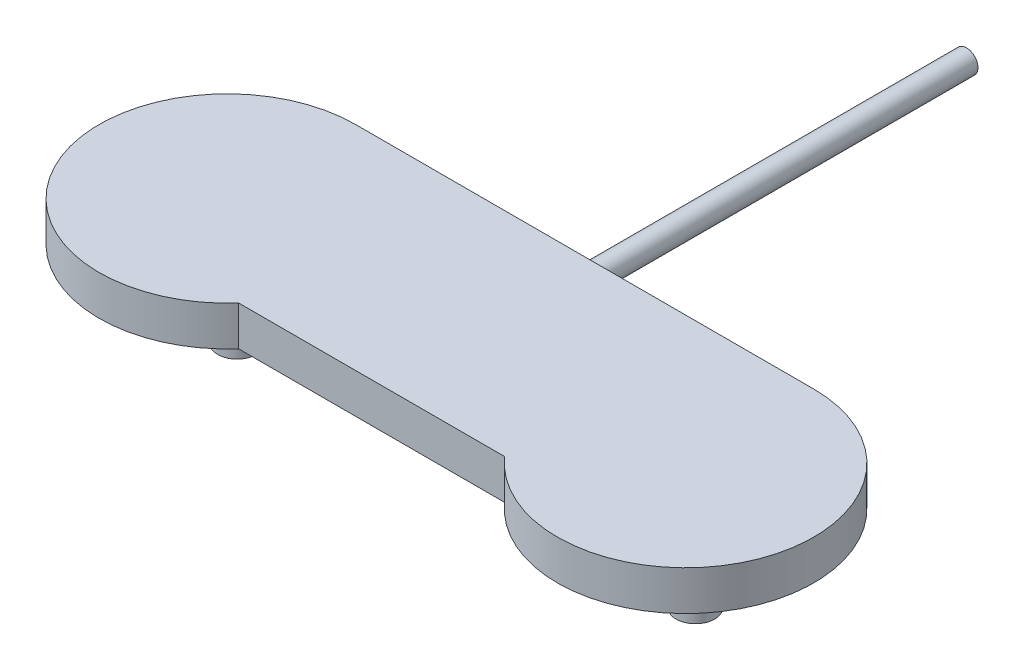
from build123d import *

# Parameters (mm, degrees)
BOSS_EXTRUDE1_DEPTH = 5
SKETCH2_R           = 2.444777137
BOSS_EXTRUDE2_DEPTH = 3
SKETCH4_R           = 1.447783819
BOSS_EXTRUDE3_DEPTH = 48


with BuildPart() as part:
    # Sketch1 → Boss-Extrude1 (new body)
    with BuildSketch(Plane(origin=(0, 0, 0), x_dir=(1, 0, 0), z_dir=(0, 1, 0))):
        with BuildLine():
            Line((0, 16.15299729), (57.736574248, 16.15299729))
            ThreePointArc((57.736574248, 16.15299729), (72.459068519, -6.645862163), (45.621959745, -10.684354773))
            Line((45.621959745, -10.684354773), (12.114614503, -10.684354773))
            ThreePointArc((12.114614503, -10.684354773), (-14.722494271, -6.645862163), (0, 16.15299729))
        make_face()
    extrude(amount=BOSS_EXTRUDE1_DEPTH)

    # Sketch2 → Boss-Extrude2 (add)
    with BuildSketch(Plane(origin=(0, 0, 0), x_dir=(1, 0, 0), z_dir=(0, 1, 0))):
        with Locations((-8.414564217, 7.18153284)):
            Circle(SKETCH2_R)
        with Locations((-8.414564217, -7.18153284)):
            Circle(SKETCH2_R)
        with Locations((8.414564217, 7.18153284)):
            Circle(SKETCH2_R)
        with Locations((8.414564217, -7.18153284)):
            Circle(SKETCH2_R)
        with Locations((66.151138464, 7.18153284)):
            Circle(SKETCH2_R)
        with Locations((66.151138464, -7.18153284)):
            Circle(SKETCH2_R)
        with Locations((49.322010031, -7.18153284)):
            Circle(SKETCH2_R)
        with Locations((49.322010031, 7.18153284)):
            Circle(SKETCH2_R)
    extrude(amount=-BOSS_EXTRUDE2_DEPTH)

    # Sketch4 → Boss-Extrude3 (add)
    with BuildSketch(Plane(origin=(0, 0, -16.15299729), x_dir=(-1, 0, 0), z_dir=(0, 0, -1))):
        with Locations((-28.970152838, 2.400681273)):
            Circle(SKETCH4_R)
    extrude(amount=BOSS_EXTRUDE3_DEPTH)


solid = part.part
